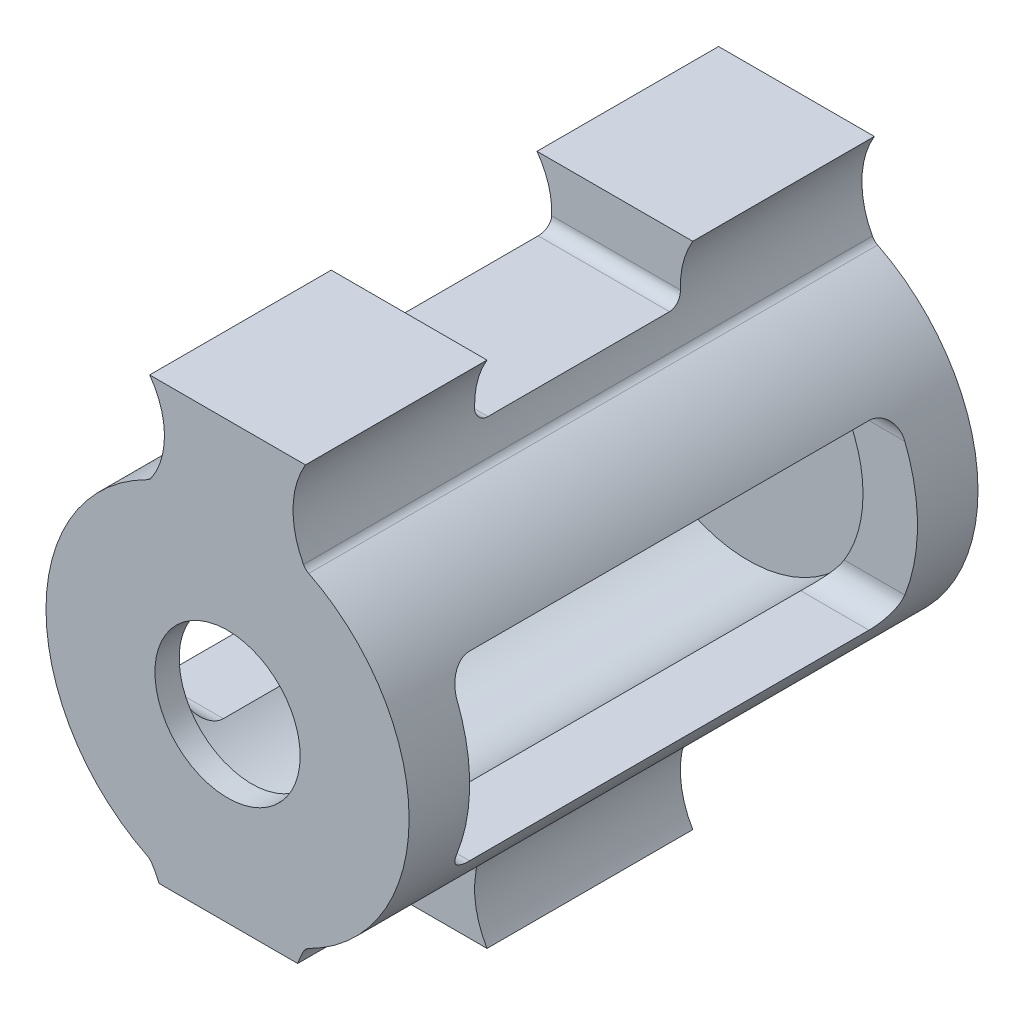
from build123d import *

# Parameters (mm, degrees)
BOSS_EXTRUDE1_DEPTH      = 114.3
BOSS_EXTRUDE1_DEPTH_BACK = 5.08
SKETCH1_R                = 26.67
CUT_EXTRUDE1_DEPTH       = 138.431798378
CUT_EXTRUDE1_DEPTH_BACK  = 138.431798378
SKETCH3_W                = 43.18
SKETCH3_H                = 12.7
SKETCH3_W_2              = 38.1
SKETCH3_H_2              = 15.494
FILLET1_R                = 2.54
FILLET2_R                = 2.54
CUT_EXTRUDE2_DEPTH       = 138.43179854
CUT_EXTRUDE2_DEPTH_BACK  = 138.43179854
SKETCH5_W                = 93.98
SKETCH5_H                = 38.1
FILLET3_R                = 5.08
SKETCH6_R                = 26.67
SKETCH6_R_2              = 5.08
BOSS_EXTRUDE2_DEPTH      = 10.16
BOSS_EXTRUDE3_START      = -5.08
SKETCH7_R                = 26.67
SKETCH7_R_2              = 15.24
BOSS_EXTRUDE3_DEPTH      = 5.08


with BuildPart() as part:
    # Sketch1 → Boss-Extrude1 (new, two sides: drawn at the far end of the back side and taken through both)
    with BuildSketch(Plane.XY.offset(-BOSS_EXTRUDE1_DEPTH_BACK)):
        with BuildLine():
            Line((16.347645029, 53.464597223), (-16.347645029, 53.464597223))
            ThreePointArc((-16.347645029, 53.464597223), (-13.241885492, 43.939597223), (-16.347645029, 34.414597223))
            ThreePointArc((-16.347645029, 34.414597223), (-38.1, 0), (-16.347645029, -34.414597223))
            ThreePointArc((-16.347645029, -34.414597223), (-13.241885492, -43.939597223), (-16.347645029, -53.464597223))
            Line((-16.347645029, -53.464597223), (16.347645029, -53.464597223))
            ThreePointArc((16.347645029, -53.464597223), (13.735418614, -43.939597223), (16.347645029, -34.414597223))
            ThreePointArc((16.347645029, -34.414597223), (38.1, 0), (16.347645029, 34.414597223))
            ThreePointArc((16.347645029, 34.414597223), (13.735418614, 43.939597223), (16.347645029, 53.464597223))
        make_face()
        Circle(SKETCH1_R, mode=Mode.SUBTRACT)
    extrude(amount=BOSS_EXTRUDE1_DEPTH + BOSS_EXTRUDE1_DEPTH_BACK)

    # Sketch3 → Cut-Extrude1 (cut, two sides: drawn at the far end of the back side and taken through both)
    with BuildSketch(Plane(origin=(-16.347645029, 0, 0), x_dir=(0, 0, -1), z_dir=(1, 0, 0)).offset(-CUT_EXTRUDE1_DEPTH_BACK)):
        with Locations((-54.61, 47.114597223)):
            Rectangle(SKETCH3_W, SKETCH3_H)
        with Locations((-95.25, -45.717597223)):
            Rectangle(SKETCH3_W_2, SKETCH3_H_2)
        with Locations((-13.97, -45.717597223)):
            Rectangle(SKETCH3_W_2, SKETCH3_H_2)
    extrude(amount=CUT_EXTRUDE1_DEPTH + CUT_EXTRUDE1_DEPTH_BACK, mode=Mode.SUBTRACT)

    # Fillet1
    fillet1_edges = [part.edges().sort_by_distance(p)[0] for p in [
        (0.225232803, 40.764597223, 33.02),
        (0.225232803, 40.764597223, 76.2),
        (0.165229741, -37.970597223, 76.2),
        (0.165229741, -37.970597223, 33.02),
    ]]
    fillet(fillet1_edges, radius=FILLET1_R)

    # Fillet2
    fillet2_edges = [part.edges().sort_by_distance(p)[0] for p in [
        (-16.347645029, 34.414597223, 54.61),
        (16.347645029, 34.414597223, 54.61),
        (16.347645029, -34.414597223, 54.61),
        (-16.347645029, -34.414597223, 54.61),
    ]]
    fillet(fillet2_edges, radius=FILLET2_R)

    # Sketch5 → Cut-Extrude2 (cut, two sides: drawn at the far end of the back side and taken through both)
    with BuildSketch(Plane(origin=(-16.347645029, 0, 0), x_dir=(0, 0, -1), z_dir=(1, 0, 0)).offset(-CUT_EXTRUDE2_DEPTH_BACK)):
        with Locations((-54.61, 0)):
            Rectangle(SKETCH5_W, SKETCH5_H)
    extrude(amount=CUT_EXTRUDE2_DEPTH + CUT_EXTRUDE2_DEPTH_BACK, mode=Mode.SUBTRACT)

    # Fillet3
    fillet3_edges = [part.edges().sort_by_distance(p)[0] for p in [
        (25.830339862, 19.05, 7.62),
        (25.830339862, 19.05, 101.6),
        (25.830339862, -19.05, 7.62),
        (25.830339862, -19.05, 101.6),
        (-25.830339862, -19.05, 101.6),
        (-25.830339862, -19.05, 7.62),
        (-25.830339862, 19.05, 7.62),
    ]]
    fillet(fillet3_edges, radius=FILLET3_R)

    # Sketch6 → Boss-Extrude2 (add)
    with BuildSketch(Plane(origin=(0, 0, -5.08), x_dir=(-1, 0, 0), z_dir=(0, 0, -1))):
        Circle(SKETCH6_R)
        Circle(SKETCH6_R_2, mode=Mode.SUBTRACT)
    extrude(amount=-BOSS_EXTRUDE2_DEPTH)

    # Sketch7 → Boss-Extrude3 (add)
    with BuildSketch(Plane.XY.offset(114.3).offset(BOSS_EXTRUDE3_START)):
        Circle(SKETCH7_R)
        Circle(SKETCH7_R_2, mode=Mode.SUBTRACT)
    extrude(amount=BOSS_EXTRUDE3_DEPTH)


solid = part.part
